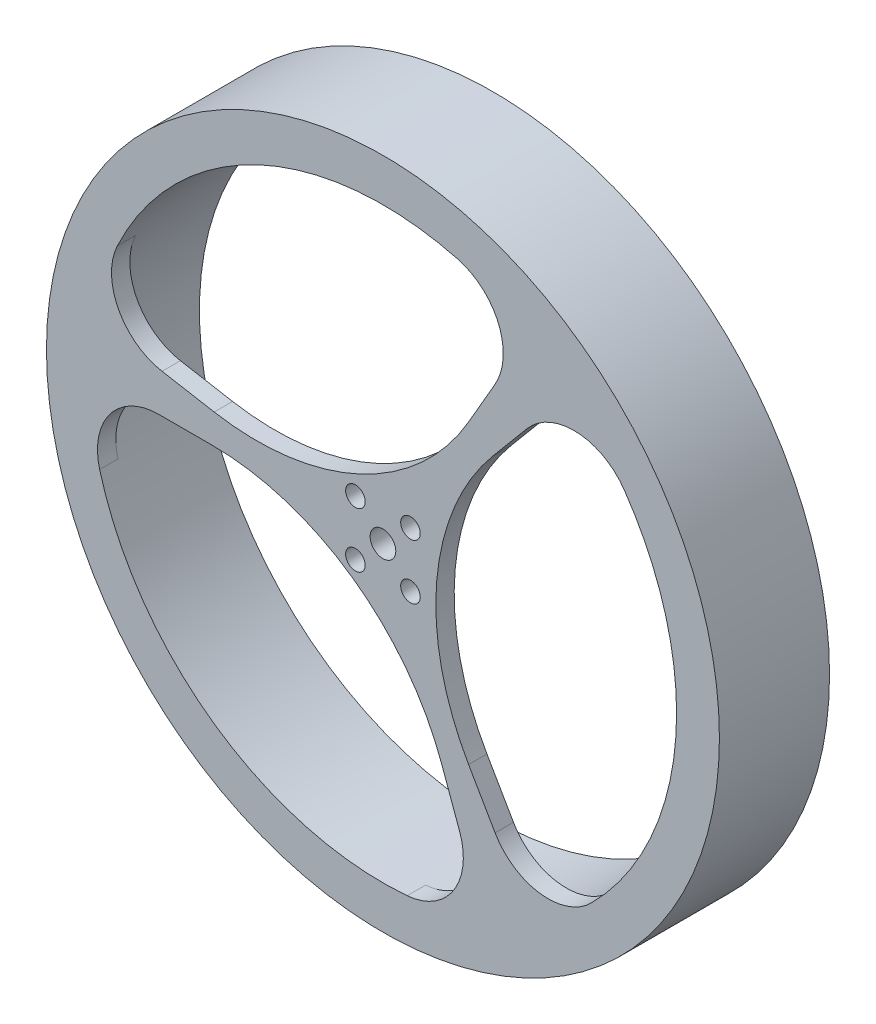
from build123d import *

# Parameters (mm, degrees)
ESQUISSE1_R             = 55
BOSS_EXTRU_1_DEPTH      = 18
ESQUISSE2_R             = 2.1
ENL_V_MAT_EXTRU_1_DEPTH = 80.837334625
ENL_V_MAT_EXTRU_2_DEPTH = 80.837334625
ENL_V_MAT_EXTRU_3_DEPTH = 80.837334625
ENL_V_START             = 15
ESQUISSE8_R             = 48
ENL_V_MAT_EXTRU_4_DEPTH = 15
CONG_3_R                = 10
CONG_4_R                = 10
CONG_5_R                = 60
CONG_7_R                = 40
ESQUISSE10_R            = 1.6
ENL_V_MAT_EXTRU_9_DEPTH = 80.837334785


with BuildPart() as part:
    # Esquisse1 → Boss.-Extru.1 (new body)
    with BuildSketch(Plane.XY):
        Circle(ESQUISSE1_R)
    extrude(amount=BOSS_EXTRU_1_DEPTH)

    # Esquisse2 → Enlèv. mat.-Extru.1 (cut, through all)
    with BuildSketch(Plane.XY.offset(18)):
        Circle(ESQUISSE2_R)
    extrude(amount=-ENL_V_MAT_EXTRU_1_DEPTH, mode=Mode.SUBTRACT)

    # Esquisse3 → Enlèv. mat.-Extru.2 (cut, through all)
    with BuildSketch(Plane.XY.offset(18)):
        with BuildLine():
            ThreePointArc((-7.5, 0), (-4.301823273, -6.143640332), (2.565151075, -7.047694656))
            Line((2.565151075, -7.047694656), (16.41696688, -45.105245798))
            ThreePointArc((16.41696688, -45.105245798), (-27.531668945, -39.319298126), (-48, 0))
            Line((-48, 0), (-7.5, 0))
        make_face()
        with BuildLine():
            ThreePointArc((-47.270772145, 8.335112528), (-20.285676564, 43.502773778), (24, 41.569219382))
            Line((24, 41.569219382), (3.75, 6.495190528))
            ThreePointArc((3.75, 6.495190528), (-3.169636963, 6.797308403), (-7.386058148, 1.302361333))
            Line((-7.386058148, 1.302361333), (-47.270772145, 8.335112528))
        make_face()
        with BuildLine():
            ThreePointArc((30.853805265, 36.77013327), (47.817345508, -4.183475652), (24, -41.569219382))
            Line((24, -41.569219382), (3.75, -6.495190528))
            ThreePointArc((3.75, -6.495190528), (7.471460236, -0.653668071), (4.820907073, 5.745333323))
            Line((4.820907073, 5.745333323), (30.853805265, 36.77013327))
        make_face()
    extrude(amount=-ENL_V_MAT_EXTRU_2_DEPTH, mode=Mode.SUBTRACT)

    # Esquisse7 → Enlèv. mat.-Extru.3 (cut, through all)
    with BuildSketch(Plane.XY):
        with BuildLine():
            Line((2.565151075, -7.047694656), (-27.531668945, -39.319298126))
            Line((-27.531668945, -39.319298126), (-7.5, 0))
            ThreePointArc((-7.5, 0), (-3.331557771, -4.75795759), (2.565151075, -7.047694656))
        make_face()
        with BuildLine():
            Line((4.820907073, 5.745333323), (47.817345508, -4.183475652))
            Line((47.817345508, -4.183475652), (3.75, -6.495190528))
            ThreePointArc((3.75, -6.495190528), (5.786291029, -0.506234869), (4.820907073, 5.745333323))
        make_face()
        with BuildLine():
            Line((3.75, 6.495190528), (-20.285676564, 43.502773778))
            Line((-20.285676564, 43.502773778), (-7.386058148, 1.302361333))
            ThreePointArc((-7.386058148, 1.302361333), (-2.454733258, 5.264192459), (3.75, 6.495190528))
        make_face()
    extrude(amount=ENL_V_MAT_EXTRU_3_DEPTH, mode=Mode.SUBTRACT)

    # Esquisse8 → Enlèv. mat.-Extru.4 (cut)
    with BuildSketch(Plane.XY.offset(ENL_V_START)):
        Circle(ESQUISSE8_R)
    extrude(amount=-ENL_V_MAT_EXTRU_4_DEPTH, mode=Mode.SUBTRACT)

    # Congé3
    # the kernel refuses this fillet: 10 mm, written as the material it adds along each edge
    with BuildSketch(Plane(origin=(-47.270772145, 8.335112528, 18), x_dir=(0.3028483404391726, 0.9530387624295452, 0), z_dir=(0, 0, -1))) as cong_3_piece_1:
        with BuildLine():
            CenterArc((11.416839641, 9.911490246), CONG_3_R, 172.371238355, 105.25752329)
            Line((1.505349395, 11.239029739), (0, 0))
            ThreePointArc((0, 0), (6.372189567, -0.42484682), (12.744379134, 0))
        make_face()
    extrude(amount=3)
    with BuildSketch(Plane(origin=(24, 41.569219382, 18), x_dir=(-0.9247372088845717, 0.38060621973947306, 0), z_dir=(0, 0, -1)), Plane(origin=(24, -41.569219382, 18), x_dir=(0.7919832595750325, 0.6105428048490187, 0), z_dir=(0, 0, -1)), Plane(origin=(-48, 0, 18), x_dir=(0.13275394930954024, -0.9911490245884924, 0), z_dir=(0, 0, -1))) as cong_3_piece_2:
        with BuildLine():
            CenterArc((11.416839641, -9.911490246), CONG_3_R, 82.371238355, 105.25752329)
            Line((1.505349395, -11.239029739), (0, 0))
            ThreePointArc((0, 0), (6.372189567, 0.42484682), (12.744379134, 0))
        make_face()
    extrude(amount=3)
    with BuildSketch(Plane(origin=(16.41696688, -45.105245798, 18), x_dir=(-0.34202014332566844, 0.9396926207859085, 0), z_dir=(0, 0, -1))) as cong_3_piece_3:
        with BuildLine():
            CenterArc((11.33939444, -10), CONG_3_R, 90, 105.25752329)
            ThreePointArc((1.691866661, -12.631578947), (0.42484682, -6.372189567), (0, 0))
            Line((0, 0), (11.33939444, 0))
        make_face()
    extrude(amount=3)

    # Congé4
    # the kernel refuses this fillet: 10 mm, written as the material it adds along each edge
    with BuildSketch(Plane(origin=(30.853805265, 36.77013327, 18), x_dir=(0.6739316088356829, -0.7387937375290534, 0), z_dir=(0, 0, -1))) as cong_4_piece_1:
        with BuildLine():
            CenterArc((11.416839641, 9.911490246), CONG_4_R, 172.371238355, 105.25752329)
            Line((1.505349395, 11.239029739), (0, 0))
            ThreePointArc((0, 0), (6.372189567, -0.42484682), (12.744379134, 0))
        make_face()
    extrude(amount=3)

    # Congé5
    # the kernel refuses this fillet: 60 mm, written as the material it adds along each edge
    with BuildSketch(Plane(origin=(-7.386058148, 1.302361333, 18), x_dir=(0.8285733508252506, 0.5598805250249523, 0), z_dir=(0, 0, -1)), Plane(origin=(2.565151075, -7.047694656, 18), x_dir=(-0.8991574331684032, 0.4376253082009868, 0), z_dir=(0, 0, -1))) as cong_5_piece_1:
        with BuildLine():
            CenterArc((27.479152806, -56.896321194), CONG_5_R, 108.509321534, 25.538214121)
            Line((-14.236143248, -13.770527577), (0, 0))
            ThreePointArc((0, 0), (4.215808312, -0.686940021), (8.431616624, 0))
        make_face()
    extrude(amount=3)
    with BuildSketch(Plane(origin=(3.75, 6.495190528, 18), x_dir=(0.4999999999999999, 0.8660254037844387, 0), z_dir=(0, 0, -1)), Plane(origin=(-7.5, 0, 18), x_dir=(-1, 0, 0), z_dir=(0, 0, -1))) as cong_5_piece_2:
        with BuildLine():
            CenterArc((19.806443505, -60), CONG_5_R, 90, 25.538214121)
            ThreePointArc((-6.060335973, -5.862123061), (-2.552569547, -3.424808757), (0, 0))
            Line((0, 0), (19.806443505, 0))
        make_face()
    extrude(amount=3)
    with BuildSketch(Plane(origin=(4.820907073, 5.745333323, 18), x_dir=(0.6427876096865399, 0.7660444431189776, 0), z_dir=(0, 0, -1))) as cong_5_piece_3:
        with BuildLine():
            CenterArc((19.806443505, 60), CONG_5_R, 244.461785879, 25.538214121)
            ThreePointArc((-6.060335973, 5.862123061), (-2.552569547, 3.424808757), (0, 0))
            Line((0, 0), (19.806443505, 0))
        make_face()
    extrude(amount=3)
    with BuildSketch(Plane(origin=(3.75, -6.495190528, 18), x_dir=(0.24272682168261056, 0.9700946809646254, 0), z_dir=(0, 0, -1))) as cong_5_piece_4:
        with BuildLine():
            CenterArc((27.479152806, 56.896321194), CONG_5_R, 225.952464345, 25.538214121)
            Line((-14.236143248, 13.770527577), (0, 0))
            ThreePointArc((0, 0), (4.215808312, 0.686940021), (8.431616624, 0))
        make_face()
    extrude(amount=3)

    # Congé7
    cong_7_edges = [part.edges().sort_by_distance(p)[0] for p in [
        (-2.549741992, 5.467939348, 16.5),
        (6.010245378, -0.525828336, 16.5),
        (-3.460503385, -4.942111012, 16.5),
    ]]
    fillet(cong_7_edges, radius=CONG_7_R)

    # Esquisse10 → Enlèv. mat.-Extru.9 (cut, through all)
    with BuildSketch(Plane.XY):
        with Locations((-4.5, -4.5)):
            Circle(ESQUISSE10_R)
        with Locations((-4.5, 4.5)):
            Circle(ESQUISSE10_R)
        with Locations((4.5, 4.5)):
            Circle(ESQUISSE10_R)
        with Locations((4.5, -4.5)):
            Circle(ESQUISSE10_R)
    extrude(amount=ENL_V_MAT_EXTRU_9_DEPTH, mode=Mode.SUBTRACT)


solid = part.part
